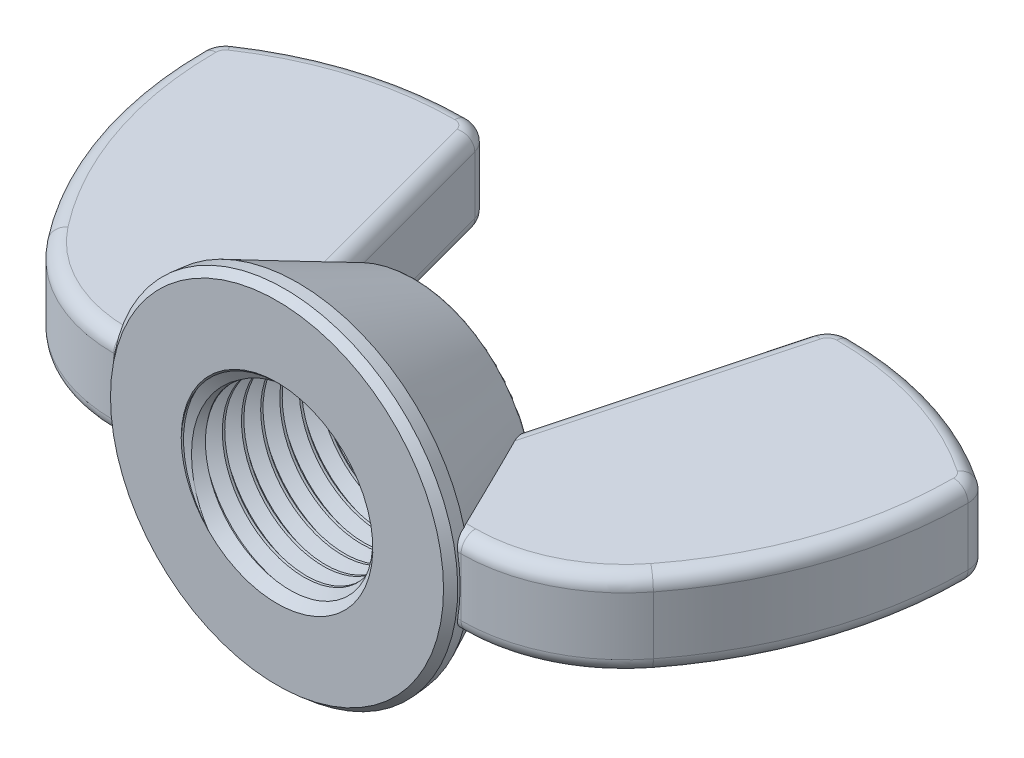
from build123d import *

# Parameters (mm, degrees)
EXTRUDE2_DEPTH     = 2.87734375
SKETCH3_R          = 11.509375
EXTRUDE1_DEPTH     = 1.3716
EXTRUDE1_DRAFT     = -5
SKETCH15_R         = 11.389375549
EXTRUDE3_DEPTH     = 7.7724
EXTRUDE3_TAPER     = 25.159502082
FILLET3_R          = 0.254
SKETCH4_R          = 6.35
CUT_EXTRUDE1_DEPTH = 38.719831825
SWEEP1_PITCH       = 1.27
SKETCH7_R          = 11.509375
CUT_EXTRUDE2_DEPTH = 38.719831855
SKETCH8_R          = 11.389375549
CUT_EXTRUDE3_DEPTH = 33.278216357
SKETCH11_R         = 6.2992
CUT_EXTRUDE5_DEPTH = 33.278216321
CUT_EXTRUDE5_TAPER = 45
CHAMFER1_SIZE      = 0.51435
CHAMFER1_SIZE2     = 0.474777118
FILLET4_R          = 0.959114583


with BuildPart() as part:
    # Sketch13 → Extrude2 (new, symmetric)
    with BuildSketch(Plane(origin=(0, 0, 0), x_dir=(1, 0, 0), z_dir=(0, 1, 0))):
        with BuildLine():
            Line((7.072802216, 0.6858), (11.509375, 0.6858))
            ThreePointArc((11.509375, 0.6858), (16.272510629, 1.7874626), (20.068188811, 4.868687785))
            ThreePointArc((20.068188811, 4.868687785), (24.02990292, 12.186174769), (25.4, 20.393709627))
            ThreePointArc((25.4, 20.393709627), (25.212888882, 21.144171331), (24.695359142, 21.718946337))
            ThreePointArc((24.695359142, 21.718946337), (18.950335713, 24.459181947), (12.655175129, 25.4))
            ThreePointArc((12.655175129, 25.4), (11.682055188, 25.069670292), (11.111119218, 24.215204229))
            Line((11.111119218, 24.215204229), (7.072802216, 9.144))
            Line((7.072802216, 9.144), (7.072802216, 0.6858))
        make_face()
    extrude(amount=EXTRUDE2_DEPTH, both=True)

    # Fillet4
    fillet4_edges = [part.edges().sort_by_distance(p)[0] for p in [
        (16.272510629, 2.87734375, -1.7874626),
        (9.291088608, -2.87734375, -0.6858),
        (24.02990292, 2.87734375, -12.186174769),
        (25.212888882, 2.87734375, -21.144171331),
        (18.950335713, 2.87734375, -24.459181947),
        (11.682055188, 2.87734375, -25.069670292),
        (9.091960717, 2.87734375, -16.679602114),
        (9.291088608, 2.87734375, -0.6858),
        (9.091960717, -2.87734375, -16.679602114),
        (11.682055188, -2.87734375, -25.069670292),
        (18.950335713, -2.87734375, -24.459181947),
        (25.212888882, -2.87734375, -21.144171331),
        (24.02990292, -2.87734375, -12.186174769),
        (16.272510629, -2.87734375, -1.7874626),
    ]]
    fillet(fillet4_edges, radius=FILLET4_R)


with BuildPart() as body_2:
    # Sketch3 → Extrude1 (with draft: the straight prism first)
    with BuildSketch(Plane.XY):
        Circle(SKETCH3_R)
    extrude(amount=-EXTRUDE1_DEPTH)
    # Extrude1: the draft: its side faces are tilted about the plane it starts from
    extrude1_sides = [body_2.faces().sort_by_distance(p)[0] for p in [
        (-11.509375, 0, -0.6858),
    ]]
    draft(extrude1_sides, Plane.XY, EXTRUDE1_DRAFT)

    # Sketch15 → Extrude3 (add)
    with BuildSketch(Plane(origin=(0, 0, -1.3716), x_dir=(-1, 0, 0), z_dir=(0, 0, -1))):
        Circle(SKETCH15_R)
    extrude(amount=EXTRUDE3_DEPTH, taper=EXTRUDE3_TAPER)

    # Fillet3
    fillet3_edges = [body_2.edges().sort_by_distance(p)[0] for p in [
        (7.738669678, 0, -9.144),
    ]]
    fillet(fillet3_edges, radius=FILLET3_R)

    # Sketch4 → Cut-Extrude1 (cut, through all)
    with BuildSketch(Plane.XY):
        Circle(SKETCH4_R)
    extrude(amount=-CUT_EXTRUDE1_DEPTH, mode=Mode.SUBTRACT)

    # Sweep1: arcs per turn and ends read off the stored shape
    # Sweep1: the profile of Sketch6 profile screwed along a right-hand helix through 10 turns, 6 arcs to a turn; built about Z, then put on its axis
    sweep1_z = Axis((0, 0, 0), (0, 0, 1))
    sweep1_corners = [(6.3503, 0, -1.111423205), (5.525110803, 0, -0.635), (5.525110803, 0, -0.47625), (6.3503, 0, 0.000173205)]
    with BuildLine(mode=Mode.PRIVATE) as sweep1_profile:
        Line(sweep1_corners[0], sweep1_corners[1])
        Line(sweep1_corners[1], sweep1_corners[2])
        Line(sweep1_corners[2], sweep1_corners[3])
        Line(sweep1_corners[3], sweep1_corners[0])
    sweep1_cap = Face(sweep1_profile.wire())
    sweep1_turn_angles = [0, 30, 60, 90, 120, 150, 180, 210, 240, 270, 300, 330, 360]
    sweep1_turn_weights = [1, 0.8660254037844387, 1, 0.8660254037844387, 1, 0.8660254037844387, 1, 0.8660254037844387, 1, 0.8660254037844387, 1, 0.8660254037844387, 1]
    sweep1_turn_rails = [Edge.make_bspline([Vector(p[0], p[1], 0).rotate(sweep1_z, sweep1_turn_angles[k]) / sweep1_turn_weights[k] + Vector(0, 0, p[2] + SWEEP1_PITCH * sweep1_turn_angles[k] / 360) for k in range(13)], [0, 0, 0, 1, 1, 2, 2, 3, 3, 4, 4, 5, 5, 6, 6, 6], 2, sweep1_turn_weights) for p in sweep1_corners]
    sweep1_turn_sides = [Face.make_surface_from_curves(sweep1_turn_rails[p[0]], sweep1_turn_rails[p[1]]) for p in [(0, 1), (1, 2), (2, 3), (3, 0)]]
    sweep1_turn = Solid(Shell([*sweep1_turn_sides, sweep1_cap, sweep1_cap.rotate(sweep1_z, 360).moved(Location((0, 0, SWEEP1_PITCH * 360 / 360)))]))
    sweep1_each = [*[sweep1_turn.moved(Location((0, 0, SWEEP1_PITCH * i))) for i in range(10)]]
    add(Plane(origin=(0, 0, 0), x_dir=(-1, 0, 0), z_dir=(0, 0, -1)) * Compound([sweep1_each[i] for i in range(0, 10, 2)]))
    add(Plane(origin=(0, 0, 0), x_dir=(-1, 0, 0), z_dir=(0, 0, -1)) * Compound([sweep1_each[i] for i in range(1, 10, 2)]))

    # Sketch7 → Cut-Extrude2 (cut, through all)
    with BuildSketch(Plane.XY):
        Circle(SKETCH7_R)
    extrude(amount=CUT_EXTRUDE2_DEPTH, mode=Mode.SUBTRACT)

    # Sketch8 → Cut-Extrude3 (cut, through all)
    with BuildSketch(Plane.XY.offset(-9.144)):
        Circle(SKETCH8_R)
    extrude(amount=-CUT_EXTRUDE3_DEPTH, mode=Mode.SUBTRACT)

    # Cut-Extrude4 cone 1 section (through the dimple's axis) → Cut-Extrude4 (revolve, cut)
    with BuildSketch(Plane(origin=(0, 0, 0), x_dir=(0, -1, 0), z_dir=(1, 0, 0))):
        Polygon((0, 0), (6.35, 0), (0, 6.35), align=None)
    revolve(axis=Axis((0, 0, 0), (0, 0, -1)), mode=Mode.SUBTRACT)

    # Sketch11 → Cut-Extrude5 (cut, through all)
    with BuildSketch(Plane.XY.offset(-9.144)):
        Circle(SKETCH11_R)
    extrude(amount=CUT_EXTRUDE5_DEPTH, taper=CUT_EXTRUDE5_TAPER, mode=Mode.SUBTRACT)

    # Chamfer1
    chamfer1_edges = [body_2.edges().sort_by_distance(p)[0] for p in [
        (-11.509375, 0, 0),
    ]]
    chamfer1_side = [body_2.faces().sort_by_distance(p)[0] for p in [
        (-11.449375275, 0, -0.6858),
    ]]
    chamfer(chamfer1_edges, length=CHAMFER1_SIZE, length2=CHAMFER1_SIZE2, reference=chamfer1_side[0])


with BuildPart() as body_3:
    # Mirror6: mirrored copy
    add(part.part.mirror(Plane(origin=(0, 0, 0), x_dir=(0, 0, 1), z_dir=(1, 0, 0))))

    # Combine2: union part, body 2
    add(part.part)
    add(body_2.part)


solid = body_3.part
